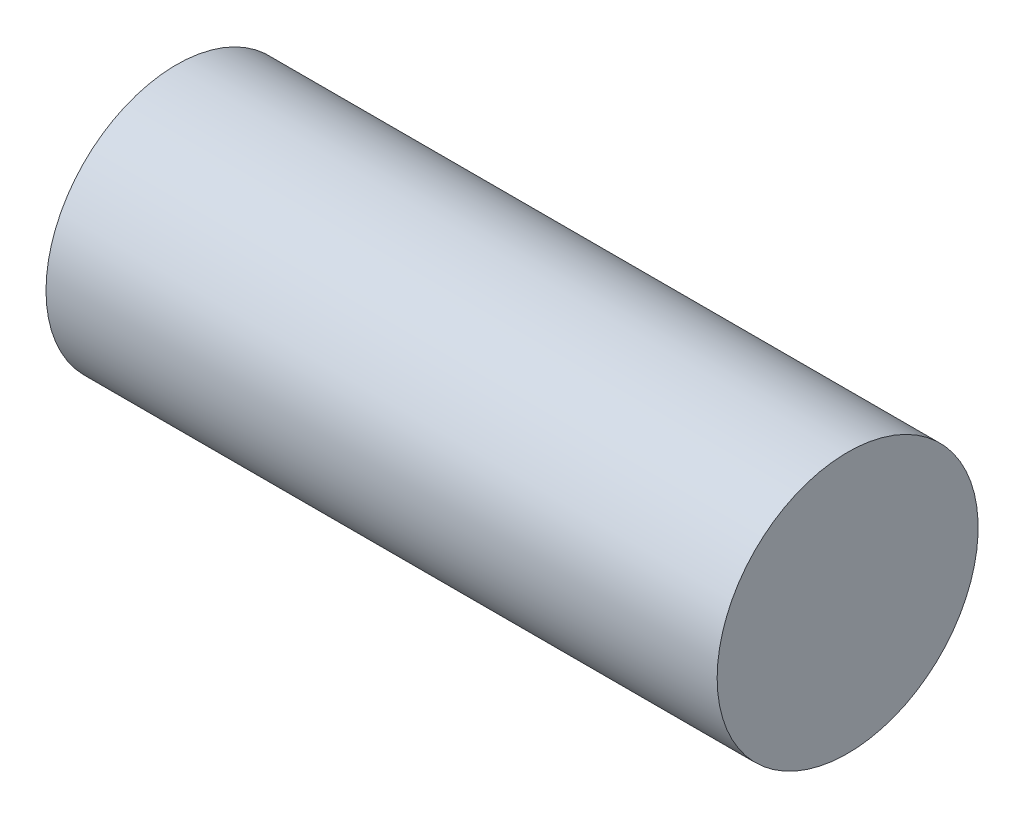
from build123d import *

# Parameters (mm, degrees)
SKETCH1_R           = 35
BOSS_EXTRUDE1_DEPTH = 90


with BuildPart() as part:
    # Sketch1 → Boss-Extrude1 (new, symmetric)
    with BuildSketch(Plane(origin=(0, 0, 0), x_dir=(0, 0, -1), z_dir=(1, 0, 0))):
        Circle(SKETCH1_R)
    extrude(amount=BOSS_EXTRUDE1_DEPTH, both=True)


solid = part.part
